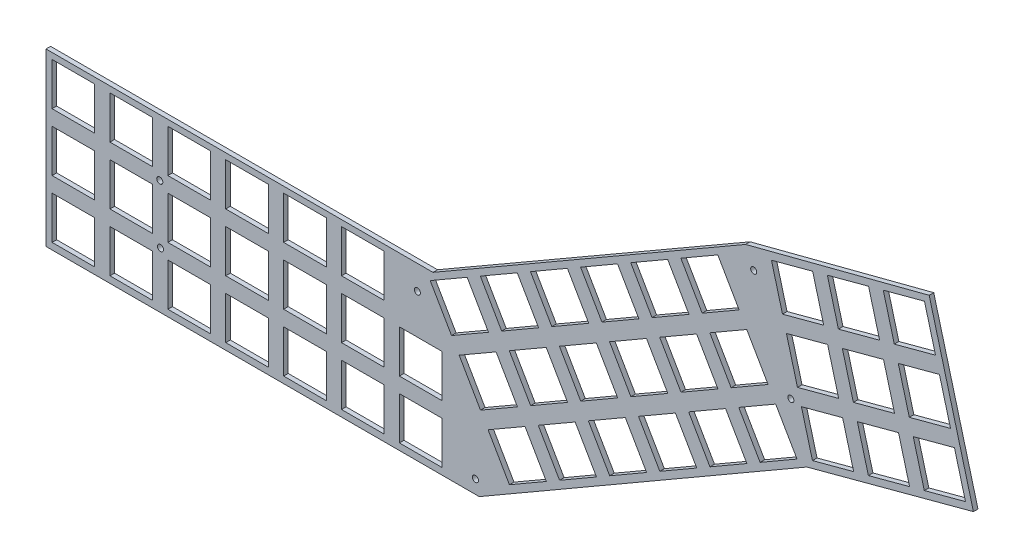
from build123d import *

# Parameters (mm, degrees)
MODEL_W            = 14
MODEL_H            = 14
MODEL_R            = 1
BOSS_EXTRU_1_DEPTH = 1.5


with BuildPart() as part:
    # Model → Boss.-Extru.1 (new body)
    with BuildSketch(Plane.XY):
        Polygon((98.150595456, 11.331634302), (152.811395456, 25.971686302), (138.282595456, 80.221514302), (78.010935456, 64.541586302), (-24.588554544, 5.301674302), (-151.608757489, 5.292943326), (-151.608757489, -50.858487698), (-9.398592544, -50.858487698), align=None)
        with Locations((-142.608757489, -41.687645053)):
            Rectangle(MODEL_W, MODEL_H, mode=Mode.SUBTRACT)
        with Locations((-123.608757489, -41.687645053)):
            Rectangle(MODEL_W, MODEL_H, mode=Mode.SUBTRACT)
        with Locations((-104.608757489, -41.687645053)):
            Rectangle(MODEL_W, MODEL_H, mode=Mode.SUBTRACT)
        with Locations((-85.608757489, -41.687645053)):
            Rectangle(MODEL_W, MODEL_H, mode=Mode.SUBTRACT)
        with Locations((-114.030844544, -32.493525698)):
            Circle(MODEL_R, mode=Mode.SUBTRACT)
        with Locations((-142.608757489, -22.687645053)):
            Rectangle(MODEL_W, MODEL_H, mode=Mode.SUBTRACT)
        with Locations((-123.608757489, -22.687645053)):
            Rectangle(MODEL_W, MODEL_H, mode=Mode.SUBTRACT)
        with Locations((-104.608757489, -22.687645053)):
            Rectangle(MODEL_W, MODEL_H, mode=Mode.SUBTRACT)
        with Locations((-85.608757489, -22.687645053)):
            Rectangle(MODEL_W, MODEL_H, mode=Mode.SUBTRACT)
        with Locations((-66.608757489, -41.687645053)):
            Rectangle(MODEL_W, MODEL_H, mode=Mode.SUBTRACT)
        with Locations((-47.608757489, -41.687645053)):
            Rectangle(MODEL_W, MODEL_H, mode=Mode.SUBTRACT)
        with Locations((-10.652844544, -46.438125698)):
            Circle(MODEL_R, mode=Mode.SUBTRACT)
        with Locations((-28.608757489, -41.687645053)):
            Rectangle(MODEL_W, MODEL_H, mode=Mode.SUBTRACT)
        with Locations((-66.608757489, -22.687645053)):
            Rectangle(MODEL_W, MODEL_H, mode=Mode.SUBTRACT)
        with Locations((-47.608757489, -22.687645053)):
            Rectangle(MODEL_W, MODEL_H, mode=Mode.SUBTRACT)
        with Locations((-28.608757489, -22.687645053)):
            Rectangle(MODEL_W, MODEL_H, mode=Mode.SUBTRACT)
        with Locations((-114.259444544, -13.418125698)):
            Circle(MODEL_R, mode=Mode.SUBTRACT)
        with Locations((-142.608757489, -3.687645053)):
            Rectangle(MODEL_W, MODEL_H, mode=Mode.SUBTRACT)
        with Locations((-123.608757489, -3.687645053)):
            Rectangle(MODEL_W, MODEL_H, mode=Mode.SUBTRACT)
        with Locations((-104.608757489, -3.687645053)):
            Rectangle(MODEL_W, MODEL_H, mode=Mode.SUBTRACT)
        with Locations((-85.608757489, -3.687645053)):
            Rectangle(MODEL_W, MODEL_H, mode=Mode.SUBTRACT)
        with Locations((-66.608757489, -3.687645053)):
            Rectangle(MODEL_W, MODEL_H, mode=Mode.SUBTRACT)
        with Locations((-47.608757489, -3.687645053)):
            Rectangle(MODEL_W, MODEL_H, mode=Mode.SUBTRACT)
        Polygon((-15.994741241, -13.947304814), (-3.870385588, -6.947304814), (3.129614412, -19.071660467), (-8.994741241, -26.071660467), align=None, mode=Mode.SUBTRACT)
        with Locations((-29.702844544, -2.648525698)):
            Circle(MODEL_R, mode=Mode.SUBTRACT)
        Polygon((-25.494741241, 2.507177858), (-13.370385588, 9.507177858), (-6.370385588, -2.617177795), (-18.494741241, -9.617177795), align=None, mode=Mode.SUBTRACT)
        Polygon((-9.040258569, 12.007177858), (3.084097084, 19.007177858), (10.084097084, 6.882822205), (-2.040258569, -0.117177795), align=None, mode=Mode.SUBTRACT)
        Polygon((-6.494741241, -30.401787486), (5.629614412, -23.401787486), (12.629614412, -35.526143139), (0.505258759, -42.526143139), align=None, mode=Mode.SUBTRACT)
        Polygon((9.959741431, -20.901787486), (22.084097084, -13.901787486), (29.084097084, -26.026143139), (16.959741431, -33.026143139), align=None, mode=Mode.SUBTRACT)
        Polygon((26.414224103, -11.401787486), (38.538579756, -4.401787486), (45.538579756, -16.526143139), (33.414224103, -23.526143139), align=None, mode=Mode.SUBTRACT)
        Polygon((0.459741431, -4.447304814), (12.584097084, 2.552695186), (19.584097084, -9.571660467), (7.459741431, -16.571660467), align=None, mode=Mode.SUBTRACT)
        Polygon((42.868706775, -1.901787486), (54.993062428, 5.098212514), (61.993062428, -7.026143139), (49.868706775, -14.026143139), align=None, mode=Mode.SUBTRACT)
        Polygon((16.914224103, 5.052695186), (29.038579756, 12.052695186), (36.038579756, -0.071660467), (23.914224103, -7.071660467), align=None, mode=Mode.SUBTRACT)
        Polygon((59.323189447, 7.598212514), (71.4475451, 14.598212514), (78.4475451, 2.473856861), (66.323189447, -4.526143139), align=None, mode=Mode.SUBTRACT)
        Polygon((33.368706775, 14.552695186), (45.493062428, 21.552695186), (52.493062428, 9.428339533), (40.368706775, 2.428339533), align=None, mode=Mode.SUBTRACT)
        Polygon((75.777672119, 17.098212514), (87.902027772, 24.098212514), (94.902027772, 11.973856861), (82.777672119, 4.973856861), align=None, mode=Mode.SUBTRACT)
        Polygon((7.414224103, 21.507177858), (19.538579756, 28.507177858), (26.538579756, 16.382822205), (14.414224103, 9.382822205), align=None, mode=Mode.SUBTRACT)
        Polygon((23.868706775, 31.007177858), (35.993062428, 38.007177858), (42.993062428, 25.882822205), (30.868706775, 18.882822205), align=None, mode=Mode.SUBTRACT)
        Polygon((49.823189447, 24.052695186), (61.9475451, 31.052695186), (68.9475451, 18.928339533), (56.823189447, 11.928339533), align=None, mode=Mode.SUBTRACT)
        Polygon((66.277672119, 33.552695186), (78.402027772, 40.552695186), (85.402027772, 28.428339533), (73.277672119, 21.428339533), align=None, mode=Mode.SUBTRACT)
        Polygon((40.323189447, 40.507177858), (52.4475451, 47.507177858), (59.4475451, 35.382822205), (47.323189447, 28.382822205), align=None, mode=Mode.SUBTRACT)
        Polygon((56.777672119, 50.007177858), (68.902027772, 57.007177858), (75.902027772, 44.882822205), (63.777672119, 37.882822205), align=None, mode=Mode.SUBTRACT)
        Polygon((99.972171674, 14.073979229), (96.348705043, 27.596940797), (109.871666611, 31.220407428), (113.495133242, 17.69744586), align=None, mode=Mode.SUBTRACT)
        with Locations((92.877555456, 28.085474302)):
            Circle(MODEL_R, mode=Mode.SUBTRACT)
        Polygon((118.324762374, 18.991541086), (114.701295742, 32.514502654), (128.22425731, 36.137969285), (131.847723942, 22.615007717), align=None, mode=Mode.SUBTRACT)
        Polygon((95.054609817, 32.426569928), (91.431143186, 45.949531496), (104.954104754, 49.572998128), (108.577571385, 36.05003656), align=None, mode=Mode.SUBTRACT)
        Polygon((136.677353073, 23.909102943), (133.053886442, 37.432064511), (146.57684801, 41.055531142), (150.200314641, 27.532569574), align=None, mode=Mode.SUBTRACT)
        Polygon((113.407200517, 37.344131785), (109.783733885, 50.867093353), (123.306695453, 54.490559985), (126.930162085, 40.967598417), align=None, mode=Mode.SUBTRACT)
        with Locations((80.685555456, 58.489274302)):
            Circle(MODEL_R, mode=Mode.SUBTRACT)
        Polygon((90.13704796, 50.779160628), (86.513581329, 64.302122196), (100.036542897, 67.925588827), (103.660009528, 54.402627259), align=None, mode=Mode.SUBTRACT)
        Polygon((131.759791216, 42.261693642), (128.136324585, 55.78465521), (141.659286153, 59.408121842), (145.282752784, 45.885160273), align=None, mode=Mode.SUBTRACT)
        Polygon((108.48963866, 55.696722485), (104.866172028, 69.219684053), (118.389133596, 72.843150684), (122.012600228, 59.320189116), align=None, mode=Mode.SUBTRACT)
        Polygon((126.842229359, 60.614284342), (123.218762728, 74.13724591), (136.741724296, 77.760712541), (140.365190927, 64.237750973), align=None, mode=Mode.SUBTRACT)
    extrude(amount=BOSS_EXTRU_1_DEPTH)


solid = part.part
